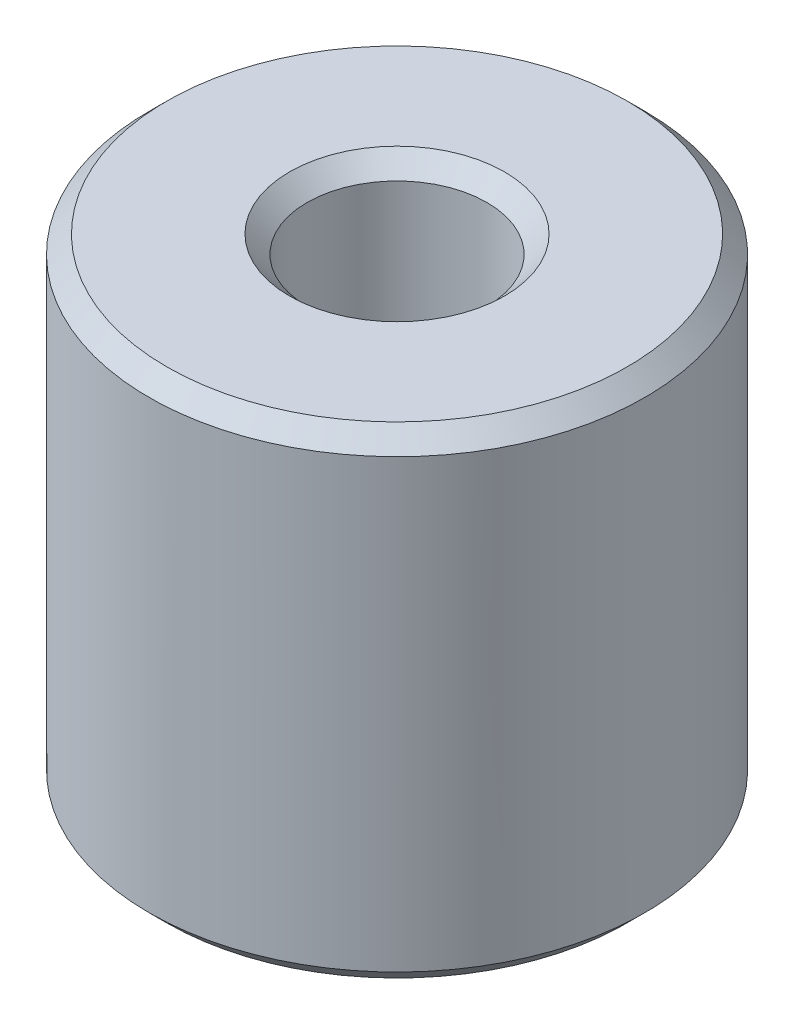
from build123d import *

# Parameters (mm, degrees)
SKETCH1_R           = 15
BOSS_EXTRUDE1_DEPTH = 29.141543856
SKETCH2_R           = 5.439421119
CUT_EXTRUDE1_DEPTH  = 37.044827345
CHAMFER1_SIZE       = 1.068076641


with BuildPart() as part:
    # Sketch1 → Boss-Extrude1 (new body)
    with BuildSketch(Plane(origin=(0, 0, 0), x_dir=(1, 0, 0), z_dir=(0, 1, 0))):
        Circle(SKETCH1_R)
    extrude(amount=BOSS_EXTRUDE1_DEPTH)

    # Sketch2 → Cut-Extrude1 (cut, through all)
    with BuildSketch(Plane(origin=(0, 0, 0), x_dir=(1, 0, 0), z_dir=(0, 1, 0))):
        Circle(SKETCH2_R)
    extrude(amount=CUT_EXTRUDE1_DEPTH, mode=Mode.SUBTRACT)

    # Chamfer1
    chamfer1_edges = [part.edges().sort_by_distance(p)[0] for p in [
        (-5.439421119, 29.141543856, 0),
        (-5.439421119, 0, 0),
        (-15, 0, 0),
        (-15, 29.141543856, 0),
    ]]
    chamfer(chamfer1_edges, length=CHAMFER1_SIZE)


solid = part.part
